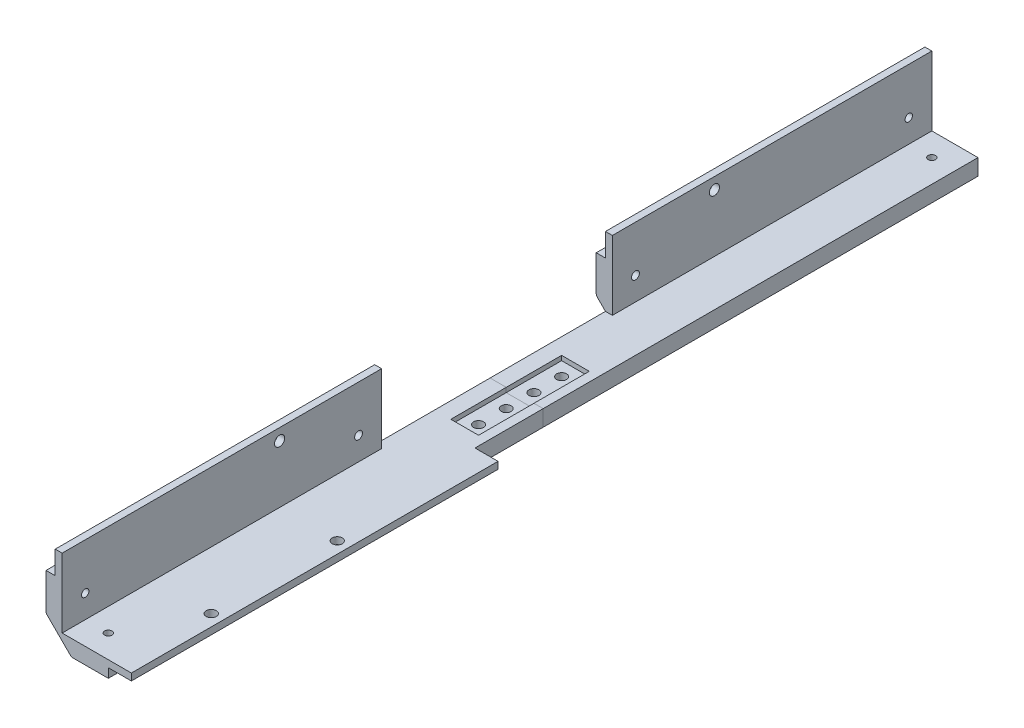
from build123d import *

# Parameters (mm, degrees)
BOSS_EXTRUDE1_DEPTH                  = 188.45
FILLET1_R                            = 1.5
SKETCH6_W                            = 188.45
SKETCH6_H                            = 3
BOSS_EXTRUDE2_DEPTH                  = 10
SKETCH7_W                            = 13
SKETCH7_H                            = 188.45
BOSS_EXTRUDE3_DEPTH                  = 4
SKETCH8_W                            = 3
SKETCH8_H                            = 188.45
BOSS_EXTRUDE4_DEPTH                  = 10
SKETCH9_W                            = 188.45
SKETCH9_H                            = 13
BOSS_EXTRUDE5_DEPTH                  = 4
CSK_FOR_M3_SFHCS1_D                  = 3.2
CSK_FOR_M3_SFHCS1_CSINK_D            = 6.72
CSK_FOR_M3_SFHCS1_CSINK_ANGLE        = 90
CSK_FOR_M3_SFHCS2_D                  = 3.2
CSK_FOR_M3_SFHCS2_CSINK_D            = 6.72
CSK_FOR_M3_SFHCS2_CSINK_ANGLE        = 90
F_4_4_4_4_DIAMETER_HOLE1_D           = 4.4
F_4_4_4_4_DIAMETER_HOLE1_DEPTH       = 10
F_4_4_4_4_DIAMETER_HOLE1_TIP         = 1.321893362
F_4_4_4_4_DIAMETER_HOLE2_D           = 4.4
F_4_4_4_4_DIAMETER_HOLE2_DEPTH       = 10
F_4_4_4_4_DIAMETER_HOLE2_TIP         = 1.321893362
SKETCH26_W                           = 50
SKETCH26_H                           = 30
CUT_EXTRUDE4_DEPTH                   = 10
SKETCH14_W                           = 10
SKETCH14_H                           = 218
CUT_EXTRUDE1_DEPTH                   = 10
SKETCH22_W                           = 12
SKETCH22_H                           = 48
CUT_EXTRUDE3_DEPTH                   = 2
F_4_3_START                          = -5
F_4_3_4_3_DIAMETER_HOLE2_OUTLINE_R   = 2.15
F_4_3_4_3_DIAMETER_HOLE2_DEPTH       = 3
F_4_3_4_3_DIAMETER_HOLE2_2_OUTLINE_R = 2.15
F_4_3_4_3_DIAMETER_HOLE2_2_DEPTH     = 3


with BuildPart() as part:
    # Sketch1 → Boss-Extrude1 (new body)
    with BuildSketch(Plane.XY.offset(280)):
        Polygon((-7, 4), (4, -7), (7, -7), (7, -3), (20, -3), (20, 0), (0, 0), (0, 20), (-3, 20), (-3, 7), (-7, 7), align=None)
    extrude(amount=-BOSS_EXTRUDE1_DEPTH)

    # Fillet1
    fillet1_edges = [part.edges().sort_by_distance(p)[0] for p in [
        (4, -7, 185.775),
        (-7, 4, 185.775),
    ]]
    fillet(fillet1_edges, radius=FILLET1_R)

    # Sketch6 → Boss-Extrude2 (add)
    with BuildSketch(Plane(origin=(20, 0, 0), x_dir=(0, 0, -1), z_dir=(1, 0, 0))):
        with Locations((-185.775, -1.5)):
            Rectangle(SKETCH6_W, SKETCH6_H)
    extrude(amount=BOSS_EXTRUDE2_DEPTH)

    # Sketch7 → Boss-Extrude3 (add)
    with BuildSketch(Plane.XZ.offset(3)):
        with Locations((13.5, 185.775)):
            Rectangle(SKETCH7_W, SKETCH7_H)
    extrude(amount=BOSS_EXTRUDE3_DEPTH)

    # Sketch8 → Boss-Extrude4 (add)
    with BuildSketch(Plane(origin=(0, 20, 0), x_dir=(1, 0, 0), z_dir=(0, 1, 0))):
        with Locations((-1.5, -185.775)):
            Rectangle(SKETCH8_W, SKETCH8_H)
    extrude(amount=BOSS_EXTRUDE4_DEPTH)

    # Sketch9 → Boss-Extrude5 (add)
    with BuildSketch(Plane.ZY.offset(3)):
        with Locations((185.775, 13.5)):
            Rectangle(SKETCH9_W, SKETCH9_H)
    extrude(amount=BOSS_EXTRUDE5_DEPTH)

    # CSK for M3 SFHCS1 (through all)
    with Locations(Plane.XZ.offset(7)):
        with Locations((10, 270)):
            CounterSinkHole(CSK_FOR_M3_SFHCS1_D / 2, CSK_FOR_M3_SFHCS1_CSINK_D / 2, counter_sink_angle=CSK_FOR_M3_SFHCS1_CSINK_ANGLE)

    # CSK for M3 SFHCS2 (through all)
    with Locations(Plane.ZY.offset(7)):
        with Locations((270, 10)):
            CounterSinkHole(CSK_FOR_M3_SFHCS2_D / 2, CSK_FOR_M3_SFHCS2_CSINK_D / 2, counter_sink_angle=CSK_FOR_M3_SFHCS2_CSINK_ANGLE)

    # Ø4.4 (4.4) Diameter Hole1
    with Locations(Plane.ZY.offset(3)):
        with Locations((185.775, 25)):
            Hole(F_4_4_4_4_DIAMETER_HOLE1_D / 2, depth=F_4_4_4_4_DIAMETER_HOLE1_DEPTH)
            with Locations((0, 0, -(F_4_4_4_4_DIAMETER_HOLE1_DEPTH + F_4_4_4_4_DIAMETER_HOLE1_TIP / 2))):  # 118° drill point
                Cone(0, F_4_4_4_4_DIAMETER_HOLE1_D / 2, F_4_4_4_4_DIAMETER_HOLE1_TIP, mode=Mode.SUBTRACT)

    # Ø4.4 (4.4) Diameter Hole2
    with Locations(Plane.XZ.offset(3)):
        with Locations((25, 240.3875), (25, 185.775)):
            Hole(F_4_4_4_4_DIAMETER_HOLE2_D / 2, depth=F_4_4_4_4_DIAMETER_HOLE2_DEPTH)
            with Locations((0, 0, -(F_4_4_4_4_DIAMETER_HOLE2_DEPTH + F_4_4_4_4_DIAMETER_HOLE2_TIP / 2))):  # 118° drill point
                Cone(0, F_4_4_4_4_DIAMETER_HOLE2_D / 2, F_4_4_4_4_DIAMETER_HOLE2_TIP, mode=Mode.SUBTRACT)

    # Sketch26 → Cut-Extrude4 (cut)
    with BuildSketch(Plane.ZY.offset(7)):
        with Locations((116.55, 15)):
            Rectangle(SKETCH26_W, SKETCH26_H)
    extrude(amount=-CUT_EXTRUDE4_DEPTH, mode=Mode.SUBTRACT)


with BuildPart() as body_2:
    # Mirror1: read off the stored shape, not the designer's step
    # Mirror1: mirrored copy
    add(part.part.mirror(Plane.XY.offset(91.55)))


with BuildPart() as cut_extrude1_tool:
    # Sketch14 → Cut-Extrude1 (new body)
    with BuildSketch(Plane.XZ.offset(3)):
        with Locations((25, 12.1)):
            Rectangle(SKETCH14_W, SKETCH14_H)
    extrude(amount=-CUT_EXTRUDE1_DEPTH)


with BuildPart() as part_1:
    add(part.part)

    # Cut-Extrude1: cut by cut_extrude1_tool
    add(cut_extrude1_tool.part, mode=Mode.SUBTRACT)


with BuildPart() as body_2_1:
    add(body_2.part)

    # Cut-Extrude1: cut by cut_extrude1_tool
    add(cut_extrude1_tool.part, mode=Mode.SUBTRACT)


with BuildPart() as cut_extrude3_tool:
    # Sketch22 → Cut-Extrude3 (new body)
    with BuildSketch(Plane(origin=(0, 0, 0), x_dir=(1, 0, 0), z_dir=(0, 1, 0))):
        with Locations((10, -91.55)):
            Rectangle(SKETCH22_W, SKETCH22_H)
    extrude(amount=-CUT_EXTRUDE3_DEPTH)


with BuildPart() as part_2:
    add(part_1.part)

    # Cut-Extrude3: cut by cut_extrude3_tool
    add(cut_extrude3_tool.part, mode=Mode.SUBTRACT)

    # 4.3 _4.3_ Diameter Hole2 2 outline → 4.3 _4.3_ Diameter Hole2 2 (cut)
    with BuildSketch(Plane(origin=(0, 0, 0), x_dir=(1, 0, 0), z_dir=(0, 1, 0)).offset(F_4_3_START)):
        with Locations((10, -109.55)):
            Circle(F_4_3_4_3_DIAMETER_HOLE2_2_OUTLINE_R)
        with Locations((10, -97.55)):
            Circle(F_4_3_4_3_DIAMETER_HOLE2_2_OUTLINE_R)
    extrude(amount=F_4_3_4_3_DIAMETER_HOLE2_2_DEPTH, mode=Mode.SUBTRACT)

    # CSK for M3 SFHCS3 2 outline → CSK for M3 SFHCS3 2 (revolve, cut)
    with BuildSketch(Plane(origin=(0, 10, 151.55), x_dir=(0, 1, 0), z_dir=(0, 0, -1))):
        Polygon((1.7, -5.34), (1.7, 0), (0, 0), (0, -7), (3.36, -7), align=None)
    revolve(axis=Axis((0, 10, 151.55), (1, 0, 0)), mode=Mode.SUBTRACT)


with BuildPart() as body_2_2:
    add(body_2_1.part)

    # Cut-Extrude3: cut by cut_extrude3_tool
    add(cut_extrude3_tool.part, mode=Mode.SUBTRACT)

    # Ø4.3 (4.3) Diameter Hole2: read off the stored shape, not the designer's step
    # Ø4.3 (4.3) Diameter Hole2 outline → Ø4.3 (4.3) Diameter Hole2 (cut)
    with BuildSketch(Plane(origin=(0, 0, 0), x_dir=(1, 0, 0), z_dir=(0, 1, 0)).offset(F_4_3_START)):
        with Locations((10, -85.55)):
            Circle(F_4_3_4_3_DIAMETER_HOLE2_OUTLINE_R)
        with Locations((10, -73.55)):
            Circle(F_4_3_4_3_DIAMETER_HOLE2_OUTLINE_R)
    extrude(amount=F_4_3_4_3_DIAMETER_HOLE2_DEPTH, mode=Mode.SUBTRACT)

    # CSK for M3 SFHCS3: read off the stored shape, not the designer's step
    # CSK for M3 SFHCS3 outline → CSK for M3 SFHCS3 (revolve, cut)
    with BuildSketch(Plane(origin=(0, 10, 31.55), x_dir=(0, 1, 0), z_dir=(0, 0, -1))):
        Polygon((1.7, -5.34), (1.7, 0), (0, 0), (0, -7), (3.36, -7), align=None)
    revolve(axis=Axis((0, 10, 31.55), (1, 0, 0)), mode=Mode.SUBTRACT)


solid = Compound([part_2.part, body_2_2.part])
